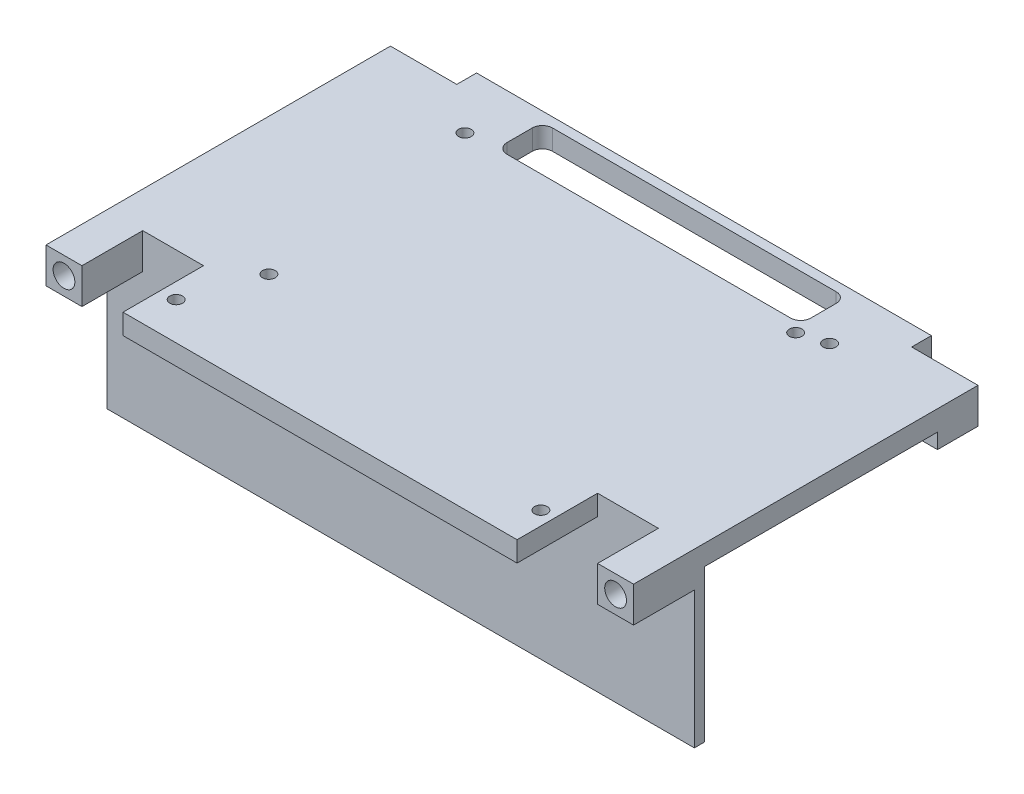
from build123d import *

# Parameters (mm, degrees)
BOSS_EXTRUDE1_DEPTH             = 4
SKETCH3_W                       = 7.1
SKETCH3_H                       = 8
BOSS_EXTRUDE3_DEPTH             = 3
SKETCH4_R                       = 2.15
CUT_EXTRUDE1_DEPTH              = 7
MIRROR2_COPY_1_SKETCH_W         = 7.1
MIRROR2_COPY_1_SKETCH_H         = 8
MIRROR2_COPY_1_DEPTH            = 3
MIRROR2_COPY_2_SKETCH_R         = 2.15
MIRROR2_COPY_2_DEPTH            = 7
SKETCH5_W                       = 60
SKETCH5_H                       = 9
CUT_EXTRUDE2_DEPTH              = 72.37226352
FILLET1_R                       = 2
SKETCH7_W                       = 101.8
SKETCH7_H                       = 1
CUT_EXTRUDE3_DEPTH              = 72.37226352
SKETCH8_W                       = 116
SKETCH8_H                       = 2
BOSS_EXTRUDE4_DEPTH             = 30
SKETCH9_W                       = 12
SKETCH9_H                       = 18
CUT_EXTRUDE4_DEPTH              = 10
SKETCH10_W                      = 7.1
SKETCH10_H                      = 4
BOSS_EXTRUDE5_DEPTH             = 3
SKETCH12_W                      = 1.5
SKETCH12_H                      = 4
BOSS_EXTRUDE6_DEPTH             = 2
SKETCH13_W                      = 36
SKETCH13_H                      = 2
BOSS_EXTRUDE7_DEPTH             = 30
SKETCH14_W                      = 1.5
SKETCH14_H                      = 4
BOSS_EXTRUDE8_DEPTH             = 1
BOSS_EXTRUDE9_REACH             = 79.055
BOSS_EXTRUDE9_DIRECTION_2_REACH = 79.055
SKETCH16_W                      = 20
SKETCH16_H                      = 28
SKETCH16_W_2                    = 14.6
SKETCH16_H_2                    = 9.2
BOSS_EXTRUDE10_DEPTH            = 2.6
SKETCH17_W                      = 12
SKETCH17_H                      = 18
CUT_EXTRUDE5_DEPTH              = 78.054785705
SKETCH18_W                      = 6
SKETCH18_H                      = 6
CUT_EXTRUDE6_DEPTH              = 79.759380394
SKETCH22_R                      = 1.25
CUT_EXTRUDE7_DEPTH              = 4
SKETCH25_W                      = 6
SKETCH25_H                      = 30
CUT_EXTRUDE11_DEPTH             = 10
CUT_EXTRUDE12_DEPTH             = 78.810282097
CUT_EXTRUDE12_DEPTH_BACK        = 78.810282097
SKETCH26_W                      = 6.843369225
SKETCH26_H                      = 31.263319976
SKETCH26_W_2                    = 6.53419365
SKETCH26_H_2                    = 28.524331859
SKETCH27_R                      = 1.25
CUT_EXTRUDE13_DEPTH             = 79.230428862
SKETCH28_W                      = 89.8
SKETCH28_H                      = 0.6
SKETCH28_W_2                    = 77.8
CUT_EXTRUDE14_DEPTH             = 79.230428862
CHAMFER1_SIZE                   = 2
SKETCH29_W                      = 20
SKETCH29_H                      = 28
CUT_EXTRUDE15_DEPTH             = 17.4
CUT_EXTRUDE16_DEPTH             = 2
SKETCH30_W                      = 89.8
SKETCH30_H                      = 1.5
SKETCH30_W_2                    = 77.8
CUT_EXTRUDE17_DEPTH             = 78.925348892
SKETCH32_W                      = 14
SKETCH32_H                      = 6
BOSS_EXTRUDE11_DEPTH            = 1
CHAMFER2_SIZE                   = 1
SKETCH34_W                      = 14
SKETCH34_H                      = 6
BOSS_EXTRUDE12_DEPTH            = 3
CHAMFER3_SIZE                   = 3
SKETCH33_R                      = 1.65
CUT_EXTRUDE18_DEPTH             = 6
CHAMFER4_SIZE                   = 3


with BuildPart() as part:
    # Sketch1 → Boss-Extrude1 (new body)
    with BuildSketch(Plane(origin=(0, 0, 0), x_dir=(1, 0, 0), z_dir=(0, 1, 0))):
        Polygon((-58, -34), (-50.9, -34), (-50.9, -41), (50.9, -41), (50.9, -34), (58, -34), (58, 34), (50.9, 34), (50.9, 41), (-50.9, 41), (-50.9, 34), (-58, 34), align=None)
    extrude(amount=BOSS_EXTRUDE1_DEPTH)

    # Sketch3 → Boss-Extrude3 (add)
    with BuildSketch(Plane.XZ):
        with Locations((-54.45, -30)):
            Rectangle(SKETCH3_W, SKETCH3_H)
    boss_extrude3 = extrude(amount=BOSS_EXTRUDE3_DEPTH)

    # Sketch4 → Cut-Extrude1 (cut)
    with BuildSketch(Plane(origin=(0, 0, -34), x_dir=(-1, 0, 0), z_dir=(0, 0, -1))):
        with Locations((54.45, 0.5)):
            Circle(SKETCH4_R)
    cut_extrude1 = extrude(amount=-CUT_EXTRUDE1_DEPTH, mode=Mode.SUBTRACT)

    # Mirror1: Boss-Extrude3, Cut-Extrude1 across plane
    add(boss_extrude3.mirror(Plane(origin=(0, 0, 0), x_dir=(0, 0, 1), z_dir=(1, 0, 0))))
    add(cut_extrude1.mirror(Plane(origin=(0, 0, 0), x_dir=(0, 0, 1), z_dir=(1, 0, 0))), mode=Mode.SUBTRACT)

    # Mirror2: Boss-Extrude3, Cut-Extrude1 across plane
    add(boss_extrude3.mirror(Plane.XY))
    add(cut_extrude1.mirror(Plane.XY), mode=Mode.SUBTRACT)

    # Mirror2 copy 1 sketch → Mirror2 copy 1 (add)
    with BuildSketch(Plane(origin=(0, 0, 0), x_dir=(-1, 0, 0), z_dir=(0, -1, 0))):
        with Locations((-54.45, -30)):
            Rectangle(MIRROR2_COPY_1_SKETCH_W, MIRROR2_COPY_1_SKETCH_H)
    extrude(amount=MIRROR2_COPY_1_DEPTH)

    # Mirror2 copy 2 sketch → Mirror2 copy 2 (cut)
    with BuildSketch(Plane.XY.offset(34)):
        with Locations((54.45, 0.5)):
            Circle(MIRROR2_COPY_2_SKETCH_R)
    extrude(amount=-MIRROR2_COPY_2_DEPTH, mode=Mode.SUBTRACT)

    # Sketch5 → Cut-Extrude2 (cut, through all)
    with BuildSketch(Plane(origin=(0, 4, 0), x_dir=(1, 0, 0), z_dir=(0, 1, 0))):
        with Locations((0, 31.5)):
            Rectangle(SKETCH5_W, SKETCH5_H)
    extrude(amount=-CUT_EXTRUDE2_DEPTH, mode=Mode.SUBTRACT)

    # Fillet1
    fillet1_edges = [part.edges().sort_by_distance(p)[0] for p in [
        (-30, 2, -27),
        (-30, 2, -36),
        (30, 2, -36),
        (30, 2, -27),
    ]]
    fillet(fillet1_edges, radius=FILLET1_R)

    # Sketch7 → Cut-Extrude3 (cut, through all)
    with BuildSketch(Plane(origin=(0, 4, 0), x_dir=(1, 0, 0), z_dir=(0, 1, 0))):
        with Locations((0, 40.5)):
            Rectangle(SKETCH7_W, SKETCH7_H)
        with Locations((0, -40.5)):
            Rectangle(SKETCH7_W, SKETCH7_H)
    extrude(amount=-CUT_EXTRUDE3_DEPTH, mode=Mode.SUBTRACT)

    # Sketch8 → Boss-Extrude4 (add)
    with BuildSketch(Plane.XZ):
        with Locations((0, 21)):
            Rectangle(SKETCH8_W, SKETCH8_H)
    extrude(amount=BOSS_EXTRUDE4_DEPTH)

    # Sketch9 → Cut-Extrude4 (cut)
    with BuildSketch(Plane(origin=(0, 4, 0), x_dir=(1, 0, 0), z_dir=(0, 1, 0))):
        with Locations((-44.9, -31)):
            Rectangle(SKETCH9_W, SKETCH9_H)
    extrude(amount=-CUT_EXTRUDE4_DEPTH, mode=Mode.SUBTRACT)

    # Sketch10 → Boss-Extrude5 (add)
    with BuildSketch(Plane.XZ.offset(3)):
        with Locations((-54.45, 24)):
            Rectangle(SKETCH10_W, SKETCH10_H)
        with Locations((54.45, 24)):
            Rectangle(SKETCH10_W, SKETCH10_H)
    extrude(amount=-BOSS_EXTRUDE5_DEPTH)

    # Sketch12 → Boss-Extrude6 (add)
    # profile 1 of 2: a face of its own
    with BuildSketch(Plane.ZY.offset(51)):
        Polygon((22, -5.8), (22, -16.2), (24.7, -13.5), (24.7, -8.5), align=None)
        with Locations((23.35, -11)):
            Rectangle(SKETCH12_W, SKETCH12_H, mode=Mode.SUBTRACT)
    # profile 2 of 2: a face of its own
    with BuildSketch(Plane.ZY.offset(51)):
        Polygon((22, -20.8), (22, -31.2), (24.7, -28.5), (24.7, -23.5), align=None)
        with Locations((23.35, -26)):
            Rectangle(SKETCH12_W, SKETCH12_H, mode=Mode.SUBTRACT)
    boss_extrude6 = extrude(amount=-BOSS_EXTRUDE6_DEPTH)

    # Mirror3: Boss-Extrude6 across plane
    add(boss_extrude6.mirror(Plane(origin=(-44.9, 0, 0), x_dir=(0, 0, 1), z_dir=(1, 0, 0))))

    # Sketch13 → Boss-Extrude7 (add)
    with BuildSketch(Plane.XZ):
        with Locations((0, -18.5)):
            Rectangle(SKETCH13_W, SKETCH13_H)
    extrude(amount=BOSS_EXTRUDE7_DEPTH)

    # Boss-Extrude9: up to this face of the body (flat: up to its plane)
    boss_extrude9_end = Plane(part.part.faces().sort_by_distance((-18, -15, -18.5))[0])
    # Sketch15 → Boss-Extrude9 (add, up to the picked face)
    with BuildSketch(Plane(origin=(0, 0, 0), x_dir=(0, 0, -1), z_dir=(1, 0, 0)), mode=Mode.PRIVATE) as boss_extrude9_sk1:
        Polygon((17.5, 0), (17.5, -5), (14.613248654, 0), align=None)
    boss_extrude9_tool1 = split(extrude(boss_extrude9_sk1.sketch, amount=-BOSS_EXTRUDE9_REACH, mode=Mode.PRIVATE), bisect_by=boss_extrude9_end, keep=Keep.BOTH, mode=Mode.PRIVATE)
    add(boss_extrude9_tool1.solids().sort_by(Axis((0, -1.666667, -16.53775), (-1, 0, 0)))[0])

    # Boss-Extrude9 direction 2: up to this face of the body (flat: up to its plane)
    boss_extrude9_direction_2_end = Plane(part.part.faces().sort_by_distance((18, -15, -18.5))[0])
    # Sketch15 → Boss-Extrude9 direction 2 (add, up to the picked face)
    with BuildSketch(Plane(origin=(0, 0, 0), x_dir=(0, 0, -1), z_dir=(1, 0, 0)), mode=Mode.PRIVATE) as boss_extrude9_direction_2_sk1:
        Polygon((17.5, 0), (17.5, -5), (14.613248654, 0), align=None)
    boss_extrude9_direction_2_tool1 = split(extrude(boss_extrude9_direction_2_sk1.sketch, amount=BOSS_EXTRUDE9_DIRECTION_2_REACH, mode=Mode.PRIVATE), bisect_by=boss_extrude9_direction_2_end, keep=Keep.BOTH, mode=Mode.PRIVATE)
    add(boss_extrude9_direction_2_tool1.solids().sort_by(Axis((0, -1.666667, -16.53775), (1, 0, 0)))[0])

    # Sketch16 → Boss-Extrude10 (add)
    with BuildSketch(Plane.XY.offset(40)):
        with Locations((28, -14)):
            Rectangle(SKETCH16_W, SKETCH16_H)
        with Locations((28, -20.4)):
            Rectangle(SKETCH16_W_2, SKETCH16_H_2, mode=Mode.SUBTRACT)
    extrude(amount=-BOSS_EXTRUDE10_DEPTH)

    # Sketch17 → Cut-Extrude5 (cut, through all)
    with BuildSketch(Plane.XZ):
        with Locations((44.9, 31)):
            Rectangle(SKETCH17_W, SKETCH17_H)
    extrude(amount=-CUT_EXTRUDE5_DEPTH, mode=Mode.SUBTRACT)

    # Sketch18 → Cut-Extrude6 (cut, through all)
    with BuildSketch(Plane(origin=(0, 4, 0), x_dir=(1, 0, 0), z_dir=(0, 1, 0))):
        with Locations((47.9, 37)):
            Rectangle(SKETCH18_W, SKETCH18_H)
        with Locations((-47.9, 37)):
            Rectangle(SKETCH18_W, SKETCH18_H)
    extrude(amount=-CUT_EXTRUDE6_DEPTH, mode=Mode.SUBTRACT)

    # Sketch22 → Cut-Extrude7 (cut)
    with BuildSketch(Plane(origin=(0, 4, 0), x_dir=(1, 0, 0), z_dir=(0, 1, 0))):
        with Locations(Location((31, 25, 0), (0, 0, 270))):
            Circle(SKETCH22_R)
        with Locations(Location((-31, -17, 0), (0, 0, 270))):
            Circle(SKETCH22_R)
    extrude(amount=-CUT_EXTRUDE7_DEPTH, mode=Mode.SUBTRACT)

    # Sketch25 → Cut-Extrude11 (cut)
    with BuildSketch(Plane(origin=(0, 0, -19.5), x_dir=(-1, 0, 0), z_dir=(0, 0, -1))):
        with Locations((-15, -15)):
            Rectangle(SKETCH25_W, SKETCH25_H)
        with Locations((15, -15)):
            Rectangle(SKETCH25_W, SKETCH25_H)
    extrude(amount=-CUT_EXTRUDE11_DEPTH, mode=Mode.SUBTRACT)

    # Sketch26 → Cut-Extrude12 (cut, two sides: drawn at the far end of the back side and taken through both)
    with BuildSketch(Plane.ZY.offset(1).offset(-CUT_EXTRUDE12_DEPTH_BACK)):
        with Locations((-23.779868126, -20.73082856)):
            Rectangle(SKETCH26_W, SKETCH26_H)
        with Locations((25.267096825, -20.06216593)):
            Rectangle(SKETCH26_W_2, SKETCH26_H_2)
    extrude(amount=CUT_EXTRUDE12_DEPTH + CUT_EXTRUDE12_DEPTH_BACK, mode=Mode.SUBTRACT)

    # Sketch27 → Cut-Extrude13 (cut, through all)
    with BuildSketch(Plane(origin=(0, 4, 0), x_dir=(1, 0, 0), z_dir=(0, 1, 0))):
        with Locations(Location((-35.8, 26.5, 0), (0, 0, 270))):
            Circle(SKETCH27_R)
        with Locations(Location((-35.8, -30.5, 0), (0, 0, 270))):
            Circle(SKETCH27_R)
        with Locations(Location((36.2, -30.5, 0), (0, 0, 270))):
            Circle(SKETCH27_R)
        with Locations(Location((36.2, 26.5, 0), (0, 0, 270))):
            Circle(SKETCH27_R)
    extrude(amount=-CUT_EXTRUDE13_DEPTH, mode=Mode.SUBTRACT)

    # Sketch28 → Cut-Extrude14 (cut, through all)
    with BuildSketch(Plane(origin=(0, 4, 0), x_dir=(1, 0, 0), z_dir=(0, 1, 0))):
        with Locations((0, 39.7)):
            Rectangle(SKETCH28_W, SKETCH28_H)
        with Locations((0, -39.7)):
            Rectangle(SKETCH28_W_2, SKETCH28_H)
    extrude(amount=-CUT_EXTRUDE14_DEPTH, mode=Mode.SUBTRACT)

    # Chamfer1
    chamfer1_edges = [part.edges().sort_by_distance(p)[0] for p in [
        (28, 0, 37.4),
    ]]
    chamfer(chamfer1_edges, length=CHAMFER1_SIZE)

    # Sketch29 → Cut-Extrude15 (cut)
    with BuildSketch(Plane.XY.offset(39.4)):
        with Locations((28, -14)):
            Rectangle(SKETCH29_W, SKETCH29_H)
    extrude(amount=-CUT_EXTRUDE15_DEPTH, mode=Mode.SUBTRACT)

    # Sketch30 → Cut-Extrude17 (cut, through all)
    with BuildSketch(Plane(origin=(0, 4, 0), x_dir=(1, 0, 0), z_dir=(0, 1, 0))):
        with Locations((0, 38.65)):
            Rectangle(SKETCH30_W, SKETCH30_H)
        with Locations((0, -38.65)):
            Rectangle(SKETCH30_W_2, SKETCH30_H)
    extrude(amount=-CUT_EXTRUDE17_DEPTH, mode=Mode.SUBTRACT)

    # Sketch32 → Boss-Extrude11 (add)
    with BuildSketch(Plane(origin=(0, 0, -19.5), x_dir=(-1, 0, 0), z_dir=(0, 0, -1))):
        with Locations((0, -15)):
            Rectangle(SKETCH32_W, SKETCH32_H)
    extrude(amount=BOSS_EXTRUDE11_DEPTH)

    # Chamfer2
    chamfer2_edges = [part.edges().sort_by_distance(p)[0] for p in [
        (0, -12, -19.5),
    ]]
    chamfer(chamfer2_edges, length=CHAMFER2_SIZE - 0.0001)  # a hair under: the kernel refuses the full size

    # Sketch34 → Boss-Extrude12 (add)
    with BuildSketch(Plane.XY.offset(-17.5)):
        with Locations((0, -15)):
            Rectangle(SKETCH34_W, SKETCH34_H)
    extrude(amount=BOSS_EXTRUDE12_DEPTH)

    # Chamfer3
    chamfer3_edges = [part.edges().sort_by_distance(p)[0] for p in [
        (0, -12, -17.5),
    ]]
    chamfer(chamfer3_edges, length=CHAMFER3_SIZE - 0.0001)  # a hair under: the kernel refuses the full size

    # Sketch33 → Cut-Extrude18 (cut)
    with BuildSketch(Plane(origin=(0, 0, -20.5), x_dir=(-1, 0, 0), z_dir=(0, 0, -1))):
        with Locations((4, -15)):
            Circle(SKETCH33_R)
        with Locations((-4, -15)):
            Circle(SKETCH33_R)
    extrude(amount=-CUT_EXTRUDE18_DEPTH, mode=Mode.SUBTRACT)

    # Chamfer4
    chamfer4_edges = [part.edges().sort_by_distance(p)[0] for p in [
        (0, 0, -19.5),
    ]]
    chamfer(chamfer4_edges, length=CHAMFER4_SIZE)


with BuildPart() as body_2:
    # Sketch14 → Boss-Extrude8 (new, symmetric)
    with BuildSketch(Plane(origin=(0, 0, 0), x_dir=(0, 0, -1), z_dir=(1, 0, 0))):
        Polygon((24.2, -8.5), (21.5, -5.8), (21.5, -16.2), (24.2, -13.5), align=None)
        with Locations((22.85, -11)):
            Rectangle(SKETCH14_W, SKETCH14_H, mode=Mode.SUBTRACT)
    extrude(amount=BOSS_EXTRUDE8_DEPTH, both=True)

    # Sketch31 → Cut-Extrude16 (cut)
    with BuildSketch(Plane.ZY.offset(1)):
        Polygon((-24.2, -8.5), (-24.2, -13.5), (-21.5, -16.2), (-21.5, -5.8), align=None)
    extrude(amount=-CUT_EXTRUDE16_DEPTH, mode=Mode.SUBTRACT)


solid = part.part
